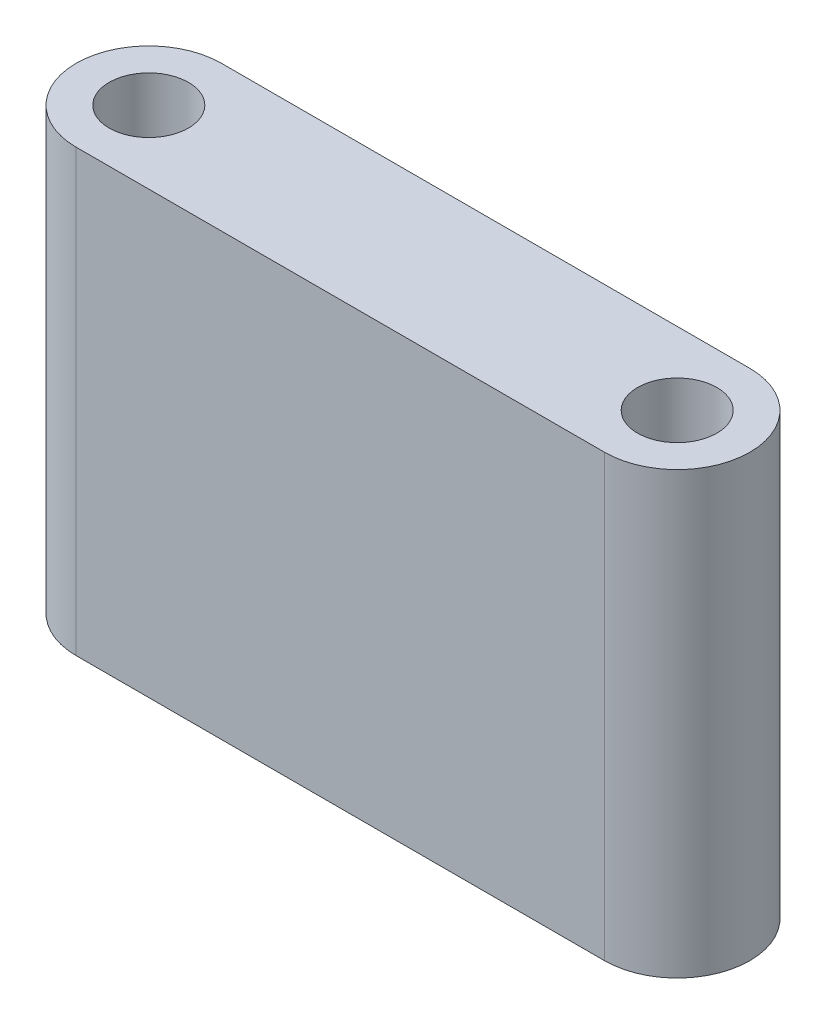
from build123d import *

# Parameters (mm, degrees)
SKETCH1_R           = 1.8
BOSS_EXTRUDE1_DEPTH = 20


with BuildPart() as part:
    # Sketch1 → Boss-Extrude1 (new body)
    with BuildSketch(Plane(origin=(0, 0, 0), x_dir=(1, 0, 0), z_dir=(0, 1, 0))):
        with BuildLine():
            Line((0, 3.3), (24, 3.3))
            ThreePointArc((24, 3.3), (27.3, 0), (24, -3.3))
            Line((24, -3.3), (0, -3.3))
            ThreePointArc((0, -3.3), (-3.3, 0), (0, 3.3))
        make_face()
        Circle(SKETCH1_R, mode=Mode.SUBTRACT)
        with Locations((24, 0)):
            Circle(SKETCH1_R, mode=Mode.SUBTRACT)
    extrude(amount=BOSS_EXTRUDE1_DEPTH)


solid = part.part
